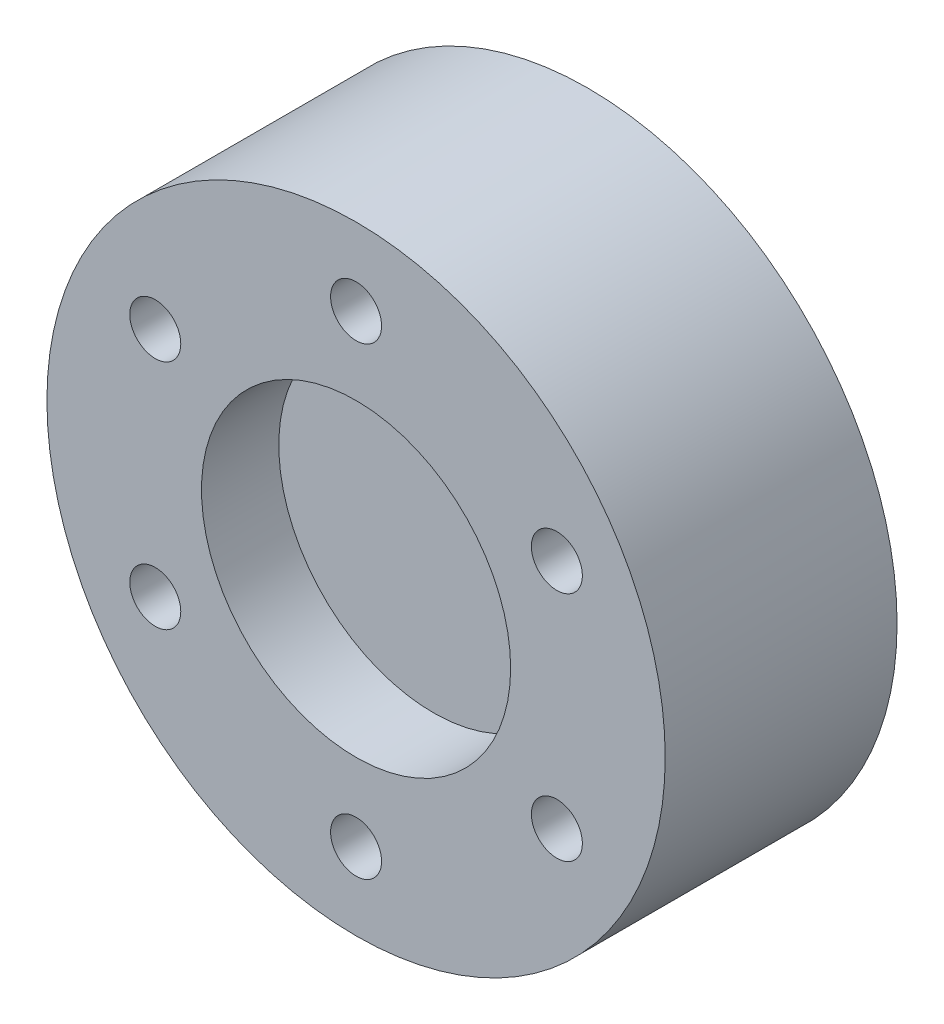
from build123d import *

# Parameters (mm, degrees)
SKETCH1_R           = 20
BOSS_EXTRUDE1_DEPTH = 15
SKETCH2_R           = 10
CUT_EXTRUDE1_DEPTH  = 5
CIRPATTERN2_COUNT   = 6
SKETCH5_R           = 17.5
CUT_EXTRUDE2_DEPTH  = 3


with BuildPart() as part:
    # Sketch1 → Boss-Extrude1 (new body)
    with BuildSketch(Plane.XY):
        Circle(SKETCH1_R)
    extrude(amount=BOSS_EXTRUDE1_DEPTH)

    # Sketch2 → Cut-Extrude1 (cut)
    with BuildSketch(Plane.XY.offset(15)):
        Circle(SKETCH2_R)
    extrude(amount=-CUT_EXTRUDE1_DEPTH, mode=Mode.SUBTRACT)

    # Sketch4 → M4x0.7 Tapped Hole1 (revolve, cut)
    with BuildSketch(Plane(origin=(0, 15, 15), x_dir=(0, -1, 0), z_dir=(1, 0, 0))):
        Polygon((0, 0), (0, 8.091420021), (1.65, 7.1), (1.65, 0), align=None)
    m4x0_7_tapped_hole1 = revolve(axis=Axis((0, 15, 21.35), (0, 0, -1)), mode=Mode.SUBTRACT)

    # CirPattern2: M4x0.7 Tapped Hole1 ×6 about axis
    cirpattern2_axis = Axis((0, 0, 10), (0, 0, 1))
    for i in range(1, CIRPATTERN2_COUNT):
        add(m4x0_7_tapped_hole1.rotate(cirpattern2_axis, i * 360 / CIRPATTERN2_COUNT), mode=Mode.SUBTRACT)

    # Sketch5 → Cut-Extrude2 (cut)
    with BuildSketch(Plane(origin=(0, 0, 0), x_dir=(-1, 0, 0), z_dir=(0, 0, -1))):
        Circle(SKETCH5_R)
    extrude(amount=-CUT_EXTRUDE2_DEPTH, mode=Mode.SUBTRACT)


solid = part.part
